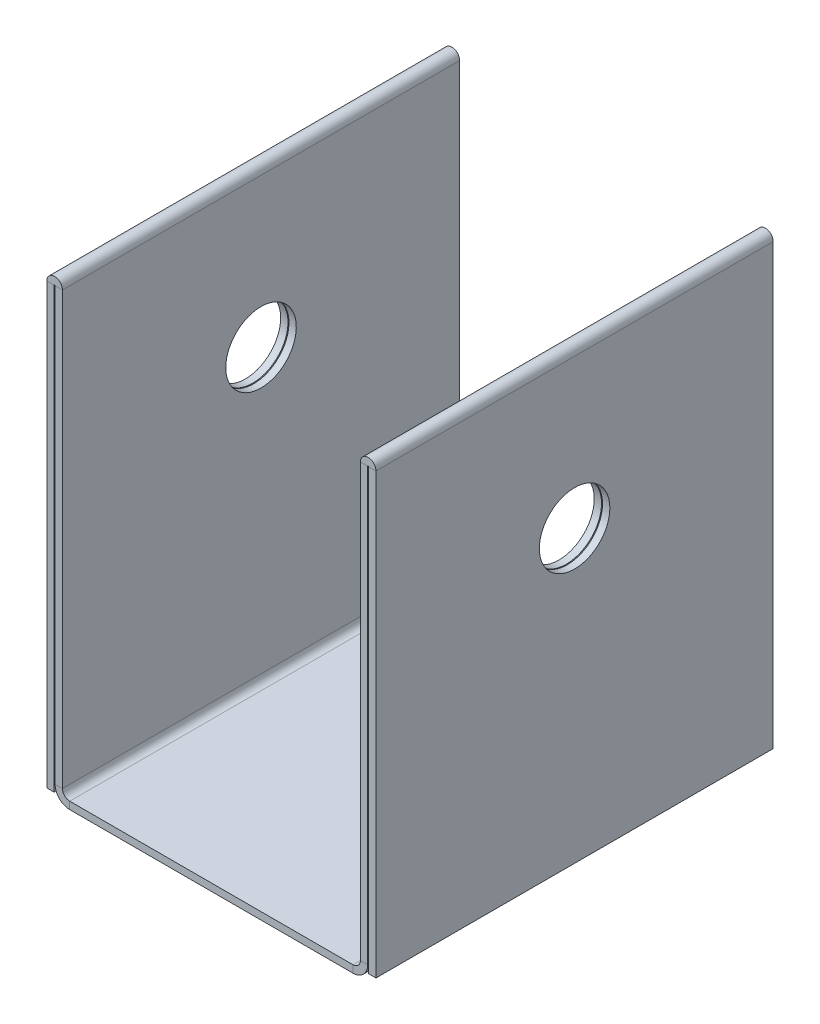
from build123d import *

# Parameters (mm, degrees)
SKETCH1_W                      = 30
SKETCH1_H                      = 40
BASE_FLANGE1_DEPTH             = 0.7366
EDGE_FLANGE1_STRIP_W           = 4.4196
EDGE_FLANGE1_STRIP_H           = 0.7366
EDGE_FLANGE1_STRIP_CUT_DEPTH   = 40
EDGE_FLANGE1_STRIP_2_W         = 4.4196
EDGE_FLANGE1_STRIP_2_H         = 0.7366
EDGE_FLANGE1_STRIP_CUT_2_DEPTH = 40
EDGE_FLANGE1_DEPTH             = 40
EDGE_FLANGE1_BEND_DEPTH        = 40
HEM1_START                     = -20
HEM1_DEPTH                     = 40
HEM1_2_DEPTH                   = 40
F_7_1_7_1_DIAMETER_HOLE1_D     = 7.1


# Read off the part's stored shape, not the designer's step: Hem1
# Sheet-metal steps are written as plain solids
with BuildPart() as part:
    # Sketch1 → Base-Flange1 (new body)
    with BuildSketch(Plane(origin=(0, 0, 0), x_dir=(1, 0, 0), z_dir=(0, 1, 0))):
        Rectangle(SKETCH1_W, SKETCH1_H)
    extrude(amount=-BASE_FLANGE1_DEPTH)

    # Edge-Flange1 strip (across the edge) → Edge-Flange1 strip cut (cut)
    with BuildSketch(Plane(origin=(15, 0, 20), x_dir=(-1, 0, 0), z_dir=(0, 0, -1))):
        with Locations((-1.4732, -0.3683)):
            Rectangle(EDGE_FLANGE1_STRIP_W, EDGE_FLANGE1_STRIP_H)
    extrude(amount=EDGE_FLANGE1_STRIP_CUT_DEPTH, mode=Mode.SUBTRACT)

    # Edge-Flange1 strip 2 (across the edge) → Edge-Flange1 strip cut 2 (cut)
    with BuildSketch(Plane(origin=(-15, 0, -20), x_dir=(1, 0, 0), z_dir=(0, 0, 1))):
        with Locations((-1.4732, -0.3683)):
            Rectangle(EDGE_FLANGE1_STRIP_2_W, EDGE_FLANGE1_STRIP_2_H)
    extrude(amount=EDGE_FLANGE1_STRIP_CUT_2_DEPTH, mode=Mode.SUBTRACT)

    # Edge-Flange1 section (across the edge) → Edge-Flange1 (add)
    with BuildSketch(Plane(origin=(15, 0, 20), x_dir=(-1, 0, 0), z_dir=(0, 0, -1))):
        with BuildLine():
            Line((-0.7366, 0.7366), (-0.7366, 45))
            Line((-0.7366, 45), (0, 45))
            Line((0, 45), (0, 0.7366))
            ThreePointArc((0, 0.7366), (0.215745145, 0.215745145), (0.7366, 0))
            Line((0.7366, 0), (0.7366, -0.7366))
            ThreePointArc((0.7366, -0.7366), (-0.30510971, -0.30510971), (-0.7366, 0.7366))
        make_face()
    extrude(amount=EDGE_FLANGE1_DEPTH)

    # Edge-Flange1 section 2 (across the edge) → Edge-Flange1 bend (add)
    with BuildSketch(Plane(origin=(-15, 0, -20), x_dir=(1, 0, 0), z_dir=(0, 0, 1))):
        with BuildLine():
            Line((-0.7366, 0.7366), (-0.7366, 45))
            Line((-0.7366, 45), (0, 45))
            Line((0, 45), (0, 0.7366))
            ThreePointArc((0, 0.7366), (0.215745145, 0.215745145), (0.7366, 0))
            Line((0.7366, 0), (0.7366, -0.7366))
            ThreePointArc((0.7366, -0.7366), (-0.30510971, -0.30510971), (-0.7366, 0.7366))
        make_face()
    extrude(amount=EDGE_FLANGE1_BEND_DEPTH)

    # Hem1 outline → Hem1 (cut)
    with BuildSketch(Plane.XY.offset(HEM1_START)):
        with BuildLine():
            ThreePointArc((15, 44.2134), (15.212984467, 44.751642306), (15.7366, 44.998409274))
            Line((15.7366, 44.998409274), (15.7366, 45))
            Line((15.7366, 45), (15, 45))
            Line((15, 45), (15, 44.2134))
        make_face()
        with BuildLine():
            Line((-15.7366, 45), (-15.7366, 44.998409274))
            ThreePointArc((-15.7366, 44.998409274), (-15.212984467, 44.751642306), (-15, 44.2134))
            Line((-15, 44.2134), (-15, 45))
            Line((-15, 45), (-15.7366, 45))
        make_face()
    extrude(amount=HEM1_DEPTH, mode=Mode.SUBTRACT)

    # Hem1 2 outline → Hem1 2 (add)
    with BuildSketch(Plane.XY.offset(HEM1_START)):
        with BuildLine():
            Line((15.8366, 0), (16.5732, 0))
            Line((16.5732, 0), (16.5732, 44.2134))
            ThreePointArc((16.5732, 44.2134), (16.324842306, 44.787015533), (15.7366, 44.998409274))
            Line((15.7366, 44.998409274), (15.7366, 44.2134))
            ThreePointArc((15.7366, 44.2134), (15.7866, 44.2634), (15.8366, 44.2134))
            Line((15.8366, 44.2134), (15.8366, 0))
        make_face()
        with BuildLine():
            Line((-16.5732, 0), (-15.8366, 0))
            Line((-15.8366, 0), (-15.8366, 44.2134))
            ThreePointArc((-15.8366, 44.2134), (-15.7866, 44.2634), (-15.7366, 44.2134))
            Line((-15.7366, 44.2134), (-15.7366, 44.998409274))
            ThreePointArc((-15.7366, 44.998409274), (-16.324842306, 44.787015533), (-16.5732, 44.2134))
            Line((-16.5732, 44.2134), (-16.5732, 0))
        make_face()
    extrude(amount=HEM1_2_DEPTH)

    # Ø7.1 (7.1) Diameter Hole1 (through all)
    with Locations(Plane(origin=(16.5732, 0, 0), x_dir=(0, 0, -1), z_dir=(1, 0, 0))):
        with Locations((0, 29.2134)):
            Hole(F_7_1_7_1_DIAMETER_HOLE1_D / 2)


solid = part.part
